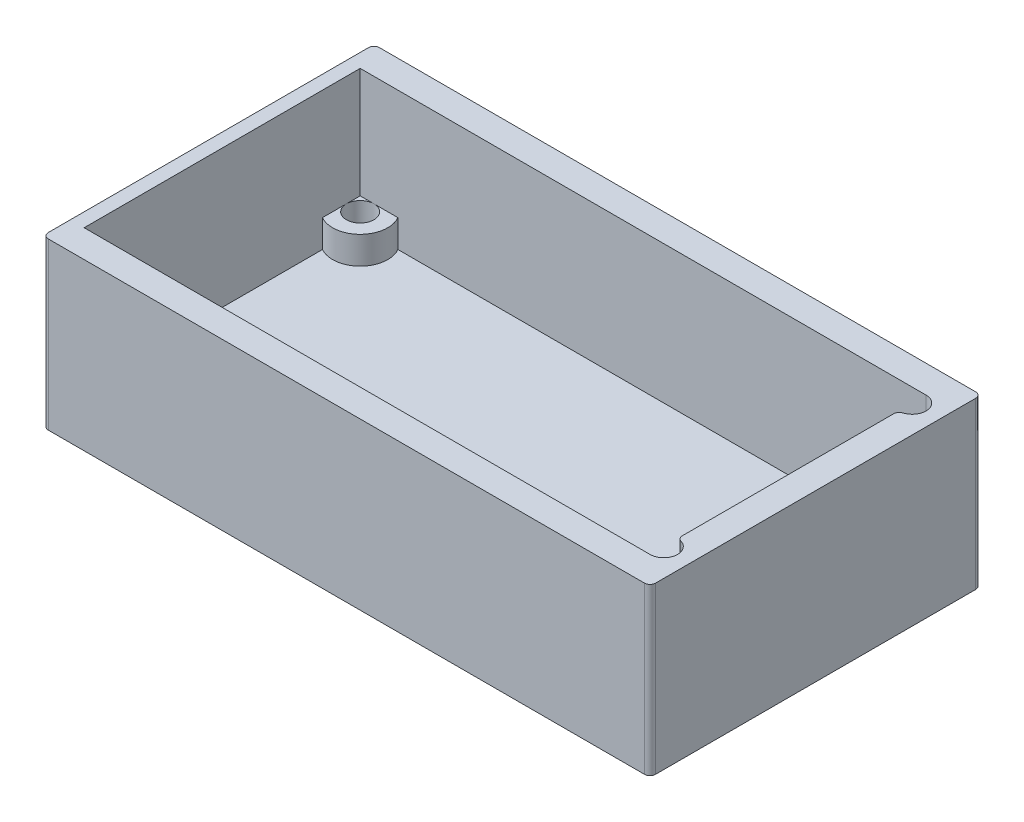
from build123d import *
from build123d.topology import SkipClean

# Parameters (mm, degrees)
SKETCH1_W               = 22
SKETCH1_H               = 12
BOSS_EXTRUDE1_DEPTH     = 6
FILLET1_R               = 0.2
SKETCH2_W               = 20.5
SKETCH2_H               = 10
CUT_EXTRUDE1_DEPTH      = 5
SKETCH3_R               = 1
SKETCH3_R_2             = 0.5
BOSS_EXTRUDE2_DEPTH     = 1
SKETCH7_R               = 1
SKETCH7_R_2             = 0.5
BOSS_EXTRUDE3_DEPTH     = 1
SKETCH8_R               = 0.5
CUT_EXTRUDE4_DEPTH      = 14.892443989
FILLET2_R               = 0.2
MIRROR5_COPY_1_SKETCH_R = 0.5
MIRROR5_COPY_1_DEPTH    = 14.892443989
MIRROR5_COPY_2_SKETCH_R = 0.5
MIRROR5_COPY_2_DEPTH    = 14.892443989
SKETCH9_R               = 0.9
CUT_EXTRUDE12_DEPTH     = 1
MIRROR7_COPY_1_SKETCH_R = 0.9
MIRROR7_COPY_1_DEPTH    = 1
MIRROR7_COPY_2_SKETCH_R = 0.9
MIRROR7_COPY_2_DEPTH    = 1


with BuildPart() as part:
    # Sketch1 → Boss-Extrude1 (new body)
    with BuildSketch(Plane(origin=(0, 0, 0), x_dir=(1, 0, 0), z_dir=(0, 1, 0))):
        Rectangle(SKETCH1_W, SKETCH1_H)
    extrude(amount=BOSS_EXTRUDE1_DEPTH)

    # Fillet1
    fillet1_edges = [part.edges().sort_by_distance(p)[0] for p in [
        (-11, 3, -6),
        (11, 3, -6),
        (11, 3, 6),
        (-11, 3, 6),
    ]]
    fillet(fillet1_edges, radius=FILLET1_R)

    # Sketch2 → Cut-Extrude1 (cut)
    with BuildSketch(Plane(origin=(0, 6, 0), x_dir=(1, 0, 0), z_dir=(0, 1, 0))):
        with Locations((-0.25, 0)):
            Rectangle(SKETCH2_W, SKETCH2_H)
    extrude(amount=-CUT_EXTRUDE1_DEPTH, mode=Mode.SUBTRACT)

    # Sketch3 → Boss-Extrude2 (add)
    with BuildSketch(Plane(origin=(0, 1, 0), x_dir=(1, 0, 0), z_dir=(0, 1, 0))):
        with Locations((10, 4.5)):
            Circle(SKETCH3_R)
        with Locations((10, 4.5)):
            Circle(SKETCH3_R_2, mode=Mode.SUBTRACT)
    boss_extrude2 = extrude(amount=BOSS_EXTRUDE2_DEPTH)

    # Mirror1: Boss-Extrude2 across plane
    add(boss_extrude2.mirror(Plane.XY))

    # Sketch7 → Boss-Extrude3 (add)
    with BuildSketch(Plane(origin=(0, 1, 0), x_dir=(1, 0, 0), z_dir=(0, 1, 0))):
        with Locations((-10, 4.5)):
            Circle(SKETCH7_R)
        with Locations((-10, 4.5)):
            Circle(SKETCH7_R_2, mode=Mode.SUBTRACT)
    boss_extrude3 = extrude(amount=BOSS_EXTRUDE3_DEPTH)

    # Mirror3: Boss-Extrude3 across plane
    add(boss_extrude3.mirror(Plane.XY))

    # Sketch8 → Cut-Extrude4 (cut, through all)
    with BuildSketch(Plane(origin=(0, 6, 0), x_dir=(1, 0, 0), z_dir=(0, 1, 0))):
        with Locations((10, 4.5)):
            Circle(SKETCH8_R)
    cut_extrude4 = extrude(amount=-CUT_EXTRUDE4_DEPTH, mode=Mode.SUBTRACT)

    # Mirror4: Cut-Extrude4 across plane
    add(cut_extrude4.mirror(Plane.XY), mode=Mode.SUBTRACT)

    # Fillet2
    fillet2_edges = [part.edges().sort_by_distance(p)[0] for p in [
        (10, 4, 4),
        (10, 4, -4),
    ]]
    fillet(fillet2_edges, radius=FILLET2_R)

    # Mirror5 copy 1 sketch → Mirror5 copy 1 (cut, through all)
    with BuildSketch(Plane(origin=(0, 6, 0), x_dir=(-1, 0, 0), z_dir=(0, 1, 0))):
        with Locations((10, 4.5)):
            Circle(MIRROR5_COPY_1_SKETCH_R)
    extrude(amount=-MIRROR5_COPY_1_DEPTH, mode=Mode.SUBTRACT)

    # Mirror5 copy 2 sketch → Mirror5 copy 2 (cut, through all)
    with BuildSketch(Plane(origin=(0, 6, 0), x_dir=(-1, 0, 0), z_dir=(0, 1, 0))):
        with Locations((10, -4.5)):
            Circle(MIRROR5_COPY_2_SKETCH_R)
    extrude(amount=-MIRROR5_COPY_2_DEPTH, mode=Mode.SUBTRACT)

    # Sketch9 → Cut-Extrude12 (cut)
    with BuildSketch(Plane(origin=(0, 0, 0), x_dir=(-1, 0, 0), z_dir=(0, -1, 0))):
        with Locations((-10, -4.5)):
            Circle(SKETCH9_R)
    cut_extrude12 = extrude(amount=-CUT_EXTRUDE12_DEPTH, mode=Mode.SUBTRACT)

    # Mirror6: Cut-Extrude12 across plane
    with SkipClean():  # the faces are left unmerged after this step: merging them gives an invalid solid
        add(cut_extrude12.mirror(Plane(origin=(0, 0, 0), x_dir=(0, 0, 1), z_dir=(1, 0, 0))), mode=Mode.SUBTRACT)

    # Mirror7 copy 1 sketch → Mirror7 copy 1 (cut)
    with BuildSketch(Plane.XZ):
        with Locations((-10, -4.5)):
            Circle(MIRROR7_COPY_1_SKETCH_R)
    extrude(amount=-MIRROR7_COPY_1_DEPTH, mode=Mode.SUBTRACT)

    # Mirror7 copy 2 sketch → Mirror7 copy 2 (cut)
    with BuildSketch(Plane(origin=(0, 0, 0), x_dir=(-1, 0, 0), z_dir=(0, -1, 0))):
        with Locations((-10, 4.5)):
            Circle(MIRROR7_COPY_2_SKETCH_R)
    extrude(amount=-MIRROR7_COPY_2_DEPTH, mode=Mode.SUBTRACT)


solid = part.part
